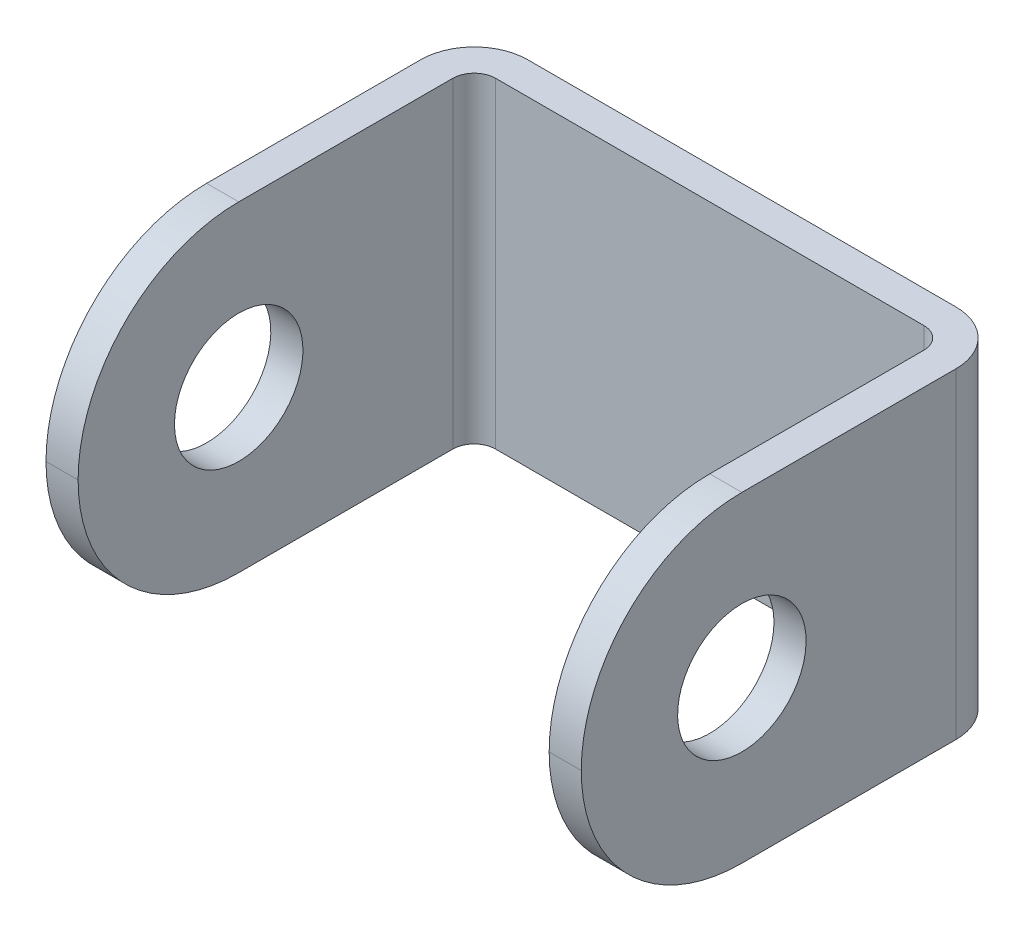
from build123d import *

# Parameters (mm, degrees)
SKICA1_W                      = 50
SKICA1_H                      = 30
P_IDAT_VYSUNUT_M1_DEPTH       = 40
ZAOBLIT1_R                    = 15
ODEBRAT_VYSUNUT_M1_DEPTH      = 50.497474683
ODEBRAT_VYSUNUT_M1_DEPTH_BACK = 50.497474683
SKICA2_W                      = 44
SKICA2_H                      = 50
ZAOBLIT2_R                    = 2
ZAOBLIT3_R                    = 5
SKICA3_R                      = 6
ODEBRAT_VYSUNUT_M2_DEPTH      = 66.76473219


with BuildPart() as part:
    # Skica1 → Přidat vysunutím1 (new body)
    with BuildSketch(Plane.XY):
        Rectangle(SKICA1_W, SKICA1_H)
    extrude(amount=P_IDAT_VYSUNUT_M1_DEPTH)

    # Zaoblit1
    zaoblit1_edges = [part.edges().sort_by_distance(p)[0] for p in [
        (0, -15, 40),
        (0, 15, 40),
    ]]
    fillet(zaoblit1_edges, radius=ZAOBLIT1_R - 0.0001)  # a hair under: the kernel refuses the full size

    # Skica2 → Odebrat vysunutím1 (cut, two sides: drawn at the far end of the back side and taken through both)
    with BuildSketch(Plane(origin=(0, 0, 0), x_dir=(1, 0, 0), z_dir=(0, 1, 0)).offset(-ODEBRAT_VYSUNUT_M1_DEPTH_BACK)):
        with Locations((0, -28)):
            Rectangle(SKICA2_W, SKICA2_H)
    extrude(amount=ODEBRAT_VYSUNUT_M1_DEPTH + ODEBRAT_VYSUNUT_M1_DEPTH_BACK, mode=Mode.SUBTRACT)

    # Zaoblit2
    zaoblit2_edges = [part.edges().sort_by_distance(p)[0] for p in [
        (-22, 0, 3),
        (22, 0, 3),
    ]]
    fillet(zaoblit2_edges, radius=ZAOBLIT2_R)

    # Zaoblit3
    zaoblit3_edges = [part.edges().sort_by_distance(p)[0] for p in [
        (25, 0, 0),
        (-25, 0, 0),
    ]]
    fillet(zaoblit3_edges, radius=ZAOBLIT3_R)

    # Skica3 → Odebrat vysunutím2 (cut, through all)
    with BuildSketch(Plane(origin=(25, 0, 0), x_dir=(0, 0, -1), z_dir=(1, 0, 0))):
        with Locations(Location((-25, 0, 0), (0, 0, 90))):
            Circle(SKICA3_R)
    extrude(amount=-ODEBRAT_VYSUNUT_M2_DEPTH, mode=Mode.SUBTRACT)


solid = part.part
